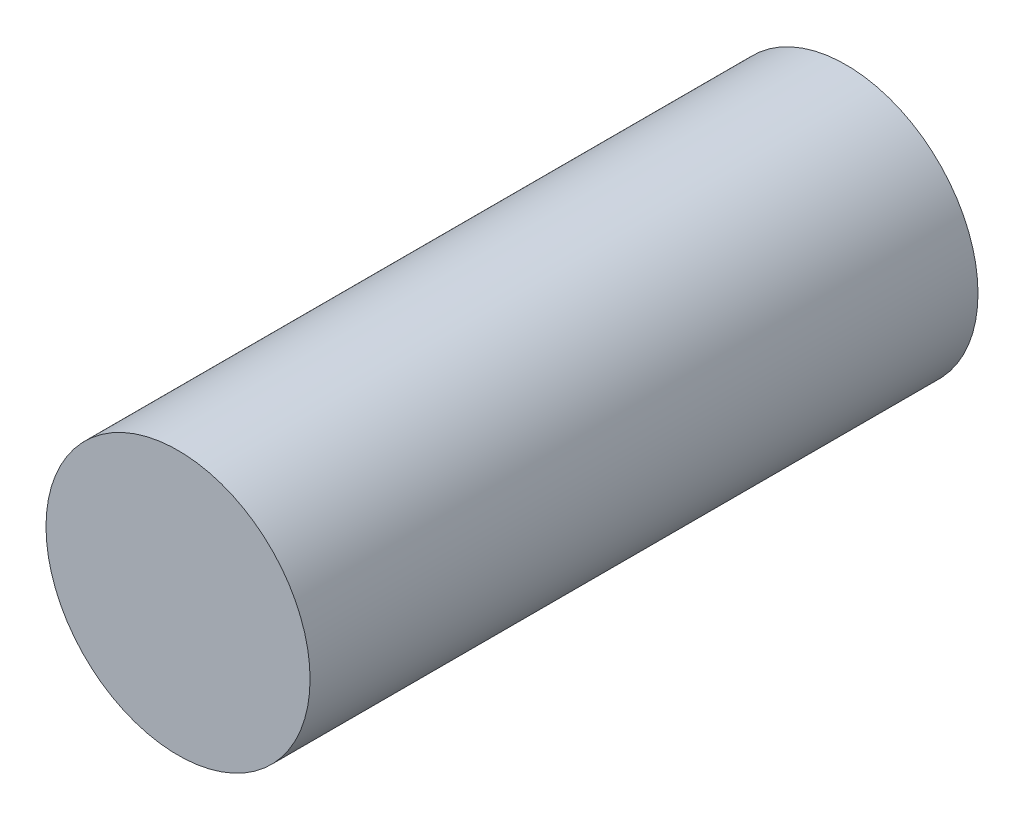
from build123d import *

# Parameters (mm, degrees)
MAIN_SKETCH_R        = 8.5
MAIN_EXTRUSION_DEPTH = 43


with BuildPart() as part:
    # Main-Sketch → Main-Extrusion (new body)
    with BuildSketch(Plane.XY):
        with Locations((-14.218044444, 13.713333333)):
            Circle(MAIN_SKETCH_R)
    extrude(amount=MAIN_EXTRUSION_DEPTH)


solid = part.part
